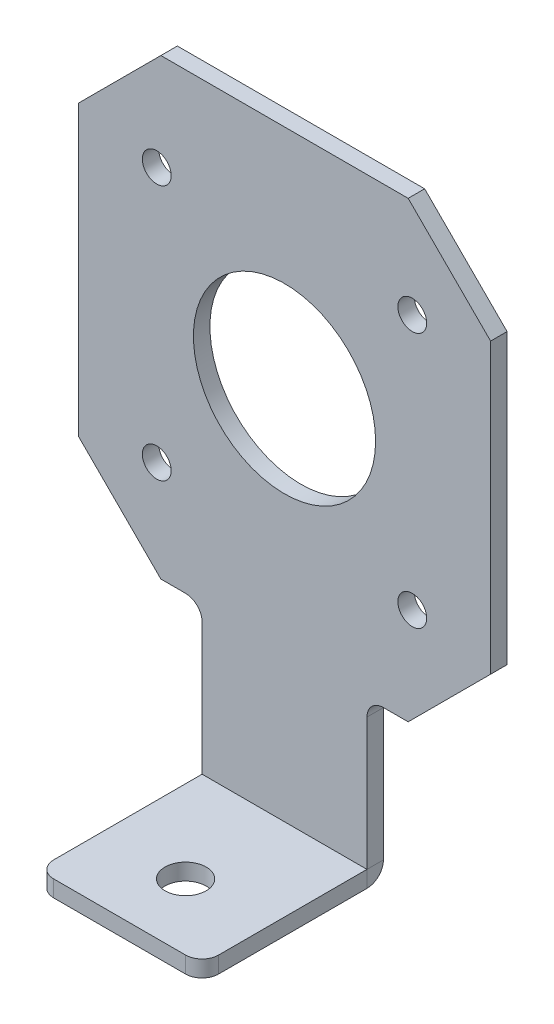
from build123d import *

# Parameters (mm, degrees)
SCHIZZO1_R                   = 1.75
SCHIZZO1_R_2                 = 11.05
ESTRUSIONE_ESTRUSIONE1_DEPTH = 2
SCHIZZO14_W                  = 20
SCHIZZO14_H                  = 2
ESTRUSIONE_ESTRUSIONE2_DEPTH = 22
SCHIZZO15_R                  = 2.5
TAGLIO_ESTRUSIONE1_DEPTH     = 10
SMUSSO1_SIZE                 = 10
RACCORDO1_R                  = 2
CONVERTI_SOLIDO2_START       = -49.5
CONVERTI_SOLIDO2_OUTLINE_R   = 2.5
CONVERTI_SOLIDO2_DEPTH       = 4
BORDO_FLANGIA1_START         = -10
BORDO_FLANGIA1_DEPTH         = 20
SCHIZZO27_R                  = 2.5
TAGLIO_ESTRUSIONE2_DEPTH     = 10
RACCORDO3_R                  = 2


# Read off the part's stored shape, not the designer's step: Converti-Solido2, Bordo-Flangia1
with BuildPart() as part:
    # Schizzo1 → Estrusione-Estrusione1 (new body)
    with BuildSketch(Plane.XY):
        Polygon((-25, -27.5), (-10, -27.5), (-10, -49.5), (10, -49.5), (10, -27.5), (25, -27.5), (25, 27.5), (-25, 27.5), align=None)
        with Locations((-15.5, 15.5)):
            Circle(SCHIZZO1_R, mode=Mode.SUBTRACT)
        with Locations((15.5, 15.5)):
            Circle(SCHIZZO1_R, mode=Mode.SUBTRACT)
        with Locations((15.5, -15.5)):
            Circle(SCHIZZO1_R, mode=Mode.SUBTRACT)
        with Locations((-15.5, -15.5)):
            Circle(SCHIZZO1_R, mode=Mode.SUBTRACT)
        Circle(SCHIZZO1_R_2, mode=Mode.SUBTRACT)
    extrude(amount=ESTRUSIONE_ESTRUSIONE1_DEPTH)

    # Schizzo14 → Estrusione-Estrusione2 (add)
    with BuildSketch(Plane.XY.offset(2)):
        with Locations((0, -48.5)):
            Rectangle(SCHIZZO14_W, SCHIZZO14_H)
    extrude(amount=ESTRUSIONE_ESTRUSIONE2_DEPTH)

    # Schizzo15 → Taglio-Estrusione1 (cut)
    with BuildSketch(Plane(origin=(0, -47.5, 0), x_dir=(1, 0, 0), z_dir=(0, 1, 0))):
        with Locations(Location((0, -14, 0), (0, 0, 270))):
            Circle(SCHIZZO15_R)
    extrude(amount=-TAGLIO_ESTRUSIONE1_DEPTH, mode=Mode.SUBTRACT)

    # Smusso1
    smusso1_edges = [part.edges().sort_by_distance(p)[0] for p in [
        (25, -27.5, 1),
        (-25, -27.5, 1),
        (-25, 27.5, 1),
        (25, 27.5, 1),
    ]]
    chamfer(smusso1_edges, length=SMUSSO1_SIZE)

    # Raccordo1
    raccordo1_edges = [part.edges().sort_by_distance(p)[0] for p in [
        (10, -27.5, 1),
        (-10, -27.5, 1),
        (0, -47.5, 2),
        (-10, -48.5, 24),
        (10, -48.5, 24),
        (0, -49.5, 0),
    ]]
    fillet(raccordo1_edges, radius=RACCORDO1_R)

    # Converti-Solido2 outline → Converti-Solido2 (cut)
    with BuildSketch(Plane(origin=(0, 0, 0), x_dir=(1, 0, 0), z_dir=(0, 1, 0)).offset(CONVERTI_SOLIDO2_START)):
        with BuildLine():
            Line((-10, 0), (-10, -22))
            ThreePointArc((-10, -22), (-9.414213562, -23.414213562), (-8, -24))
            Line((-8, -24), (8, -24))
            ThreePointArc((8, -24), (9.414213562, -23.414213562), (10, -22))
            Line((10, -22), (10, 0))
            Line((10, 0), (-10, 0))
        make_face()
        with Locations((0, -14)):
            Circle(CONVERTI_SOLIDO2_OUTLINE_R, mode=Mode.SUBTRACT)
    extrude(amount=CONVERTI_SOLIDO2_DEPTH, mode=Mode.SUBTRACT)

    # Bordo-Flangia1 outline → Bordo-Flangia1 (add)
    with BuildSketch(Plane.YZ.offset(BORDO_FLANGIA1_START)):
        with BuildLine():
            ThreePointArc((-47.5, 2), (-46.914213562, 0.585786438), (-45.5, 0))
            Line((-45.5, 0), (-45.5, 22))
            Line((-45.5, 22), (-47.5, 22))
            Line((-47.5, 22), (-47.5, 2))
        make_face()
    extrude(amount=BORDO_FLANGIA1_DEPTH)

    # Schizzo27 → Taglio-Estrusione2 (cut)
    with BuildSketch(Plane(origin=(0, -45.5, 0), x_dir=(1, 0, 0), z_dir=(0, 1, 0))):
        with Locations(Location((0, -14, 0), (0, 0, 270))):
            Circle(SCHIZZO27_R)
    extrude(amount=-TAGLIO_ESTRUSIONE2_DEPTH, mode=Mode.SUBTRACT)

    # Raccordo3
    raccordo3_edges = [part.edges().sort_by_distance(p)[0] for p in [
        (10, -46.5, 22),
        (-10, -46.5, 22),
    ]]
    fillet(raccordo3_edges, radius=RACCORDO3_R)


solid = part.part
